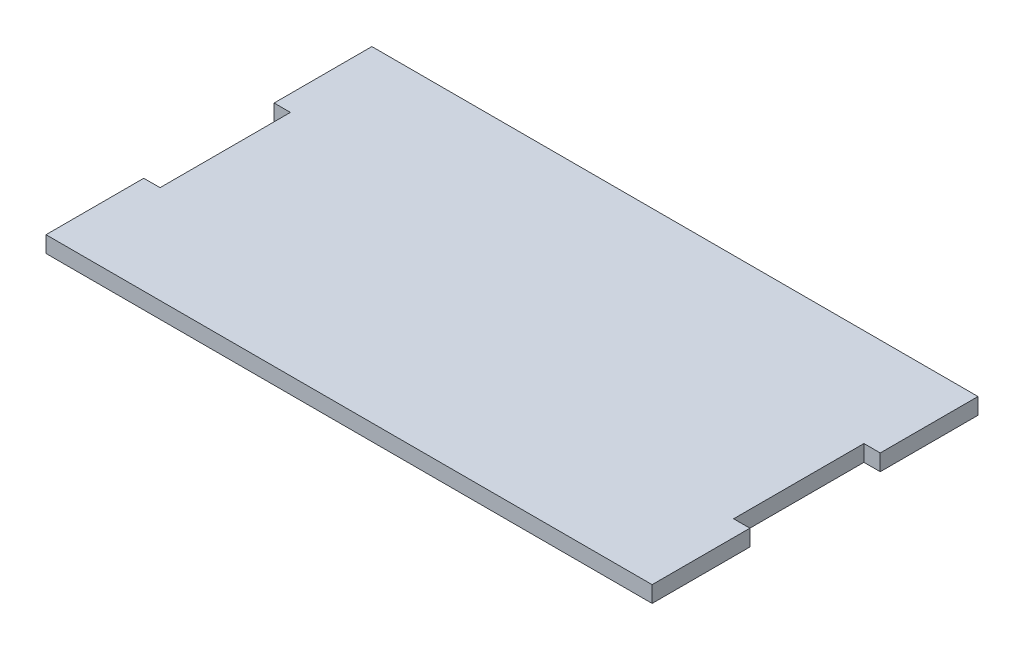
from build123d import *

# Parameters (mm, degrees)
SKIZZE1_W                       = 186
SKIZZE1_H                       = 100
AUFSATZ_LINEAR_AUSTRAGEN1_DEPTH = 5
SKIZZE2_W                       = 5
SKIZZE2_H                       = 40
SCHNITT_LINEAR_AUSTRAGEN1_DEPTH = 212.236833909


with BuildPart() as part:
    # Skizze1 → Aufsatz-Linear austragen1 (new body)
    with BuildSketch(Plane(origin=(0, 0, 0), x_dir=(1, 0, 0), z_dir=(0, 1, 0))):
        with Locations((93, 50)):
            Rectangle(SKIZZE1_W, SKIZZE1_H)
    extrude(amount=AUFSATZ_LINEAR_AUSTRAGEN1_DEPTH)

    # Skizze2 → Schnitt-Linear austragen1 (cut, through all)
    with BuildSketch(Plane(origin=(0, 5, 0), x_dir=(1, 0, 0), z_dir=(0, 1, 0))):
        with Locations((183.5, 50)):
            Rectangle(SKIZZE2_W, SKIZZE2_H)
        with Locations((2.5, 50)):
            Rectangle(SKIZZE2_W, SKIZZE2_H)
    extrude(amount=-SCHNITT_LINEAR_AUSTRAGEN1_DEPTH, mode=Mode.SUBTRACT)


solid = part.part
